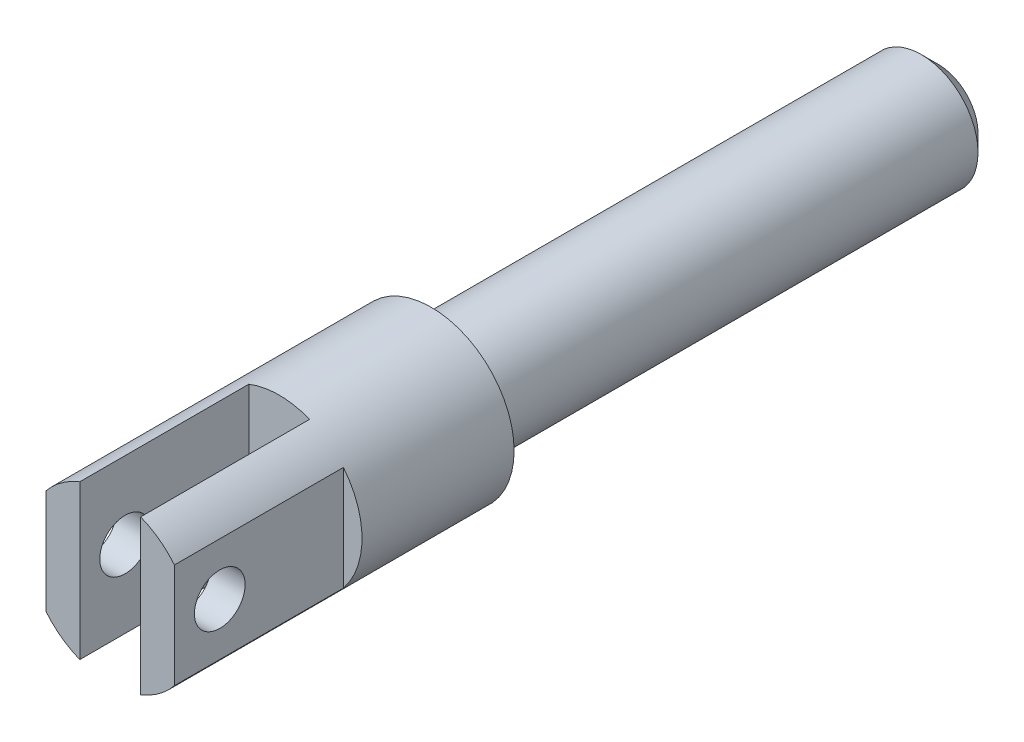
from build123d import *
from build123d.topology import SkipClean

# Parameters (mm, degrees)
SKETCH_2_R          = 4.9
EXTRUDE_1_DEPTH     = 9
EXTRUDE_2_DEPTH     = 10
SKETCH_4_R          = 1.5
CUT_EXTRUDE_1_DEPTH = 22.46392322
SKETCH_5_R          = 3.35
EXTRUDE_3_DEPTH     = 30
CHAMFER_1_SIZE      = 1


with BuildPart() as part:
    # 草图2 → 凸台-拉伸1 (new body)
    with BuildSketch(Plane.XY):
        Circle(SKETCH_2_R)
    extrude(amount=EXTRUDE_1_DEPTH)

    # 草图3 → 凸台-拉伸2 (add)
    with SkipClean():  # the faces are left unmerged after this step: merging them gives an invalid solid
        with BuildSketch(Plane.XY.offset(9)):
            with BuildLine():
                Line((-1.8, -4.557411546), (-1.8, 4.557411546))
                ThreePointArc((-1.8, 4.557411546), (-2.894085134, 3.954019631), (-3.8, 3.09354166))
                Line((-3.8, 3.09354166), (-3.8, -3.09354166))
                ThreePointArc((-3.8, -3.09354166), (-2.894085134, -3.954019631), (-1.8, -4.557411546))
            make_face()
            with BuildLine():
                Line((1.8, -4.557411546), (1.8, 4.557411546))
                ThreePointArc((1.8, 4.557411546), (2.894085134, 3.954019631), (3.8, 3.09354166))
                Line((3.8, 3.09354166), (3.8, -3.09354166))
                ThreePointArc((3.8, -3.09354166), (2.894085134, -3.954019631), (1.8, -4.557411546))
            make_face()
        extrude(amount=EXTRUDE_2_DEPTH)

    # 草图4 → 切除-拉伸1 (cut, through all)
    with SkipClean():  # the faces are left unmerged after this step: merging them gives an invalid solid
        with BuildSketch(Plane.ZY.offset(3.8)):
            with Locations((16.318814586, 0)):
                Circle(SKETCH_4_R)
        extrude(amount=-CUT_EXTRUDE_1_DEPTH, mode=Mode.SUBTRACT)

    # 草图5 → 凸台-拉伸3 (add)
    with SkipClean():  # the faces are left unmerged after this step: merging them gives an invalid solid
        with BuildSketch(Plane(origin=(0, 0, 0), x_dir=(-1, 0, 0), z_dir=(0, 0, -1))):
            Circle(SKETCH_5_R)
        extrude(amount=EXTRUDE_3_DEPTH)

    # 倒角1
    chamfer_1_edges = [part.edges().sort_by_distance(p)[0] for p in [
        (3.35, 0, -30),
    ]]
    chamfer(chamfer_1_edges, length=CHAMFER_1_SIZE)


solid = part.part
